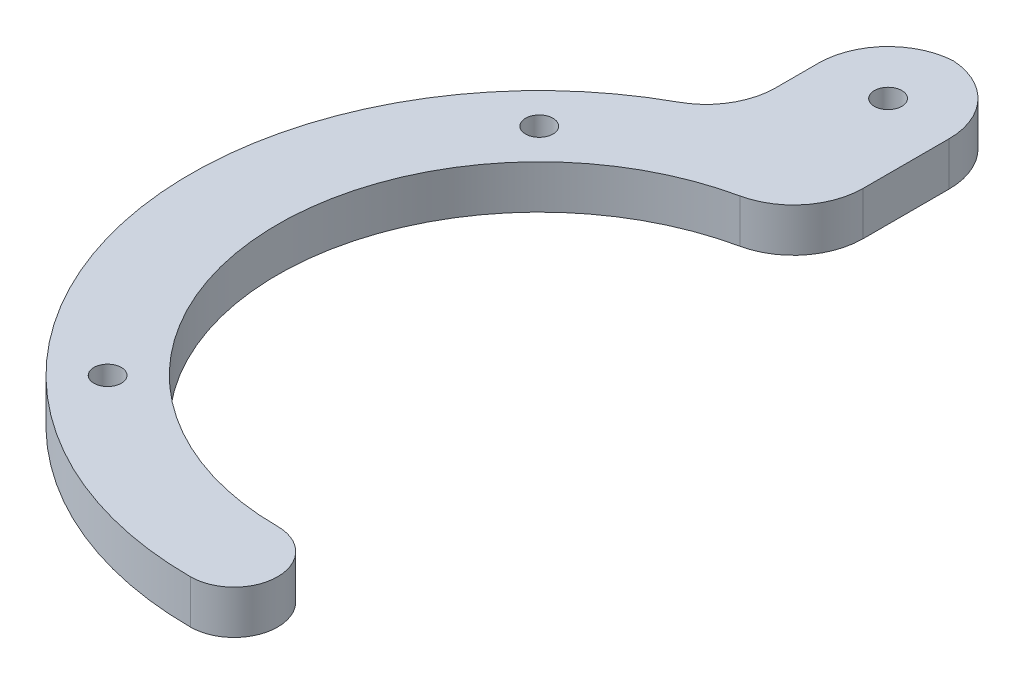
from build123d import *

# Parameters (mm, degrees)
SKETCH1_R           = 2
BOSS_EXTRUDE1_DEPTH = 6.35
FILLET1_R           = 10.16


with BuildPart() as part:
    # Sketch1 → Boss-Extrude1 (new body)
    with BuildSketch(Plane(origin=(0, 0, 0), x_dir=(1, 0, 0), z_dir=(0, 1, 0))):
        with BuildLine():
            Line((19.05, 0), (0, 0))
            Line((0, 0), (0, -22.757139607))
            ThreePointArc((0, -22.757139607), (-30.814603217, -79.553676933), (19.05, -120.65))
            ThreePointArc((19.05, -120.65), (25.4, -114.3), (19.05, -107.95))
            ThreePointArc((19.05, -107.95), (-19.05, -69.85), (19.05, -31.75))
            Line((19.05, -31.75), (19.05, 0))
        make_face()
        with Locations(Location((9.525, -9.525, 0), (0, 0, 270))):
            Circle(SKETCH1_R, mode=Mode.SUBTRACT)
        with Locations(Location((-12.380896424, -38.419103576, 0), (0, 0, 270))):
            Circle(SKETCH1_R, mode=Mode.SUBTRACT)
        with Locations(Location((-12.380896424, -101.280896424, 0), (0, 0, 270))):
            Circle(SKETCH1_R, mode=Mode.SUBTRACT)
    extrude(amount=BOSS_EXTRUDE1_DEPTH)

    # Fillet1
    # the kernel refuses this fillet: 10.16 mm, written as the material it adds along each edge
    with BuildSketch(Plane(origin=(0, 0, 22.757139607), x_dir=(0, 0, -1), z_dir=(0, 1, 0))) as fillet1_piece_1:
        with BuildLine():
            CenterArc((6.413190667, 10.16), FILLET1_R, 208.630989837, 61.369010163)
            ThreePointArc((-2.50448451, 5.291666667), (-1.175949507, 2.681941807), (0, 0))
            Line((0, 0), (6.413190667, 0))
        make_face()
    extrude(amount=6.35)
    # the kernel refuses this fillet: 10.16 mm, written as the material it takes off along each edge
    with BuildSketch(Plane(origin=(19.05, -22.696015193, 31.75), x_dir=(0, 0, -1), z_dir=(0, 1, 0))) as fillet1_2_piece_1:
        with BuildLine():
            CenterArc((9.078406077, 10.16), FILLET1_R, 192.153197469, 77.846802531)
            ThreePointArc((-0.853889939, 8.021052632), (-0.214073897, 4.033187739), (0, 0))
            Line((0, 0), (9.078406077, 0))
        make_face()
    extrude(amount=51.742030387, mode=Mode.SUBTRACT)
    with BuildSketch(Plane(origin=(0, -25.4, 0), x_dir=(1, 0, 0), z_dir=(0, 1, 0)), Plane(origin=(19.05, -25.4, 0), x_dir=(0, 0, 1), z_dir=(0, 1, 0))) as fillet1_2_piece_2:
        with BuildLine():
            CenterArc((FILLET1_R, -FILLET1_R), FILLET1_R, 90, 90)
            Line((0, -FILLET1_R), (0, 0))
            Line((0, 0), (FILLET1_R, 0))
        make_face()
    extrude(amount=57.15, mode=Mode.SUBTRACT)


solid = part.part
